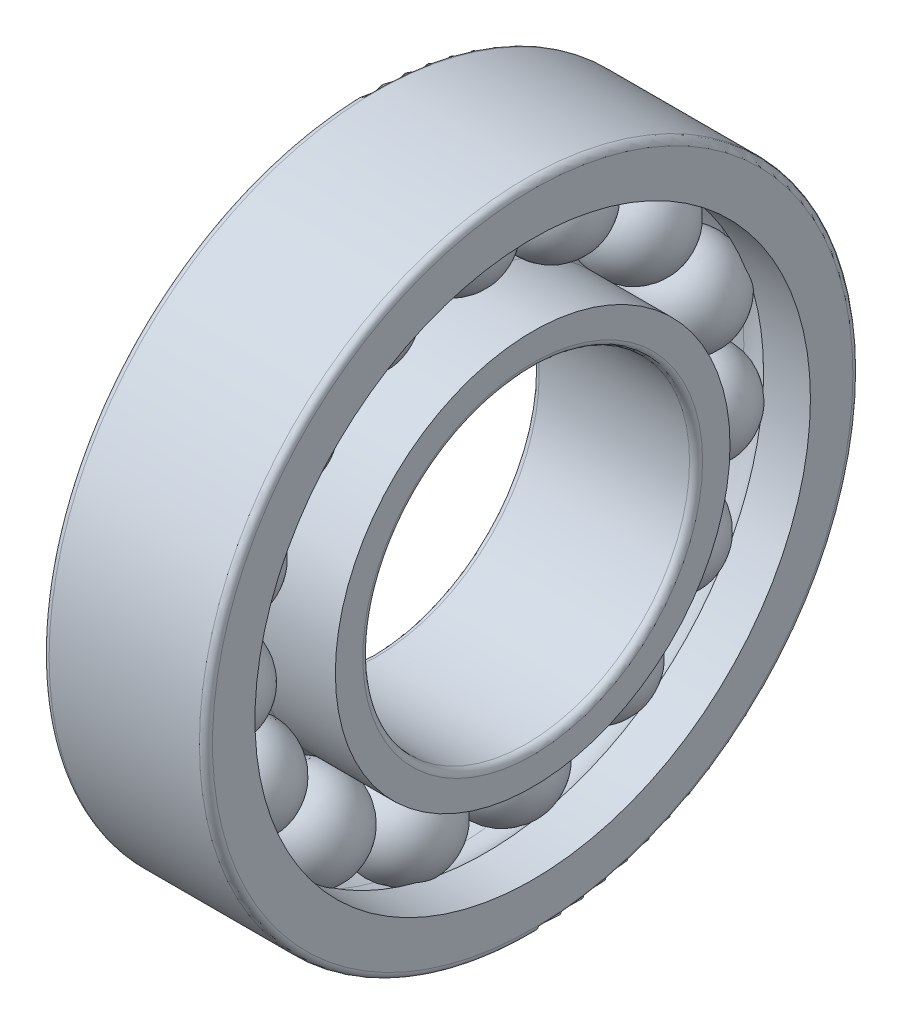
from build123d import *

# Parameters (mm, degrees)
CAGSPISKE_W         = 0.47625
CAGSPISKE_H         = 0.3175
CAGESPINE_ANGLE     = 0.001
BALLSDETAILED_COUNT = 15
BALLSDETAILED_ANGLE = 336


with BuildPart() as part:
    # CagSpiSke → CageSpine (revolve)
    with BuildSketch(Plane.XY):
        with Locations((0, 4.7625)):
            Rectangle(CAGSPISKE_W, CAGSPISKE_H)
    revolve(axis=Axis((-20.6375, 0, 0), (1, 0, 0)), revolution_arc=CAGESPINE_ANGLE)

    # BalDetSke → BallDetailed (revolve)
    with BuildSketch(Plane.XY):
        with BuildLine():
            Line((-0.9525, 4.7625), (0.9525, 4.7625))
            ThreePointArc((0.9525, 4.7625), (0, 3.81), (-0.9525, 4.7625))
        make_face()
    balldetailed = revolve(axis=Axis((-1.905, 4.7625, 0), (1, 0, 0)))

    # InnRacSke → InnerRace (revolve)
    with BuildSketch(Plane.XY):
        with BuildLine():
            Line((-0.676040864, 4.1275), (-1.5875, 4.1275))
            Line((-1.5875, 4.1275), (-1.5875, 3.302))
            ThreePointArc((-1.5875, 3.302), (-1.550302561, 3.212197439), (-1.4605, 3.175))
            Line((-1.4605, 3.175), (1.4605, 3.175))
            ThreePointArc((1.4605, 3.175), (1.550302561, 3.212197439), (1.5875, 3.302))
            Line((1.5875, 3.302), (1.5875, 3.835))
            Line((1.5875, 3.835), (0, 3.835))
            ThreePointArc((0, 3.835), (-0.368302695, 3.911260096), (-0.676040864, 4.1275))
        make_face()
    revolve(axis=Axis((-20.6375, 0, 0), (1, 0, 0)))

    # OutRacSke → OuterRace (revolve)
    with BuildSketch(Plane.XY):
        with BuildLine():
            Line((0, 5.69), (-1.5875, 5.69))
            Line((-1.5875, 5.69), (-1.5875, 6.223))
            ThreePointArc((-1.5875, 6.223), (-1.550302561, 6.312802561), (-1.4605, 6.35))
            Line((-1.4605, 6.35), (1.4605, 6.35))
            ThreePointArc((1.4605, 6.35), (1.550302561, 6.312802561), (1.5875, 6.223))
            Line((1.5875, 6.223), (1.5875, 5.3975))
            Line((1.5875, 5.3975), (0.676040864, 5.3975))
            ThreePointArc((0.676040864, 5.3975), (0.368302695, 5.613739904), (0, 5.69))
        make_face()
    revolve(axis=Axis((-20.6375, 0, 0), (1, 0, 0)))

    # BallsDetailed: BallDetailed ×15 about axis
    ballsdetailed_axis = Axis((-50, 0, 0), (1, 0, 0))
    for i in range(1, BALLSDETAILED_COUNT):
        add(balldetailed.rotate(ballsdetailed_axis, i * BALLSDETAILED_ANGLE / (BALLSDETAILED_COUNT - 1)))


solid = part.part
